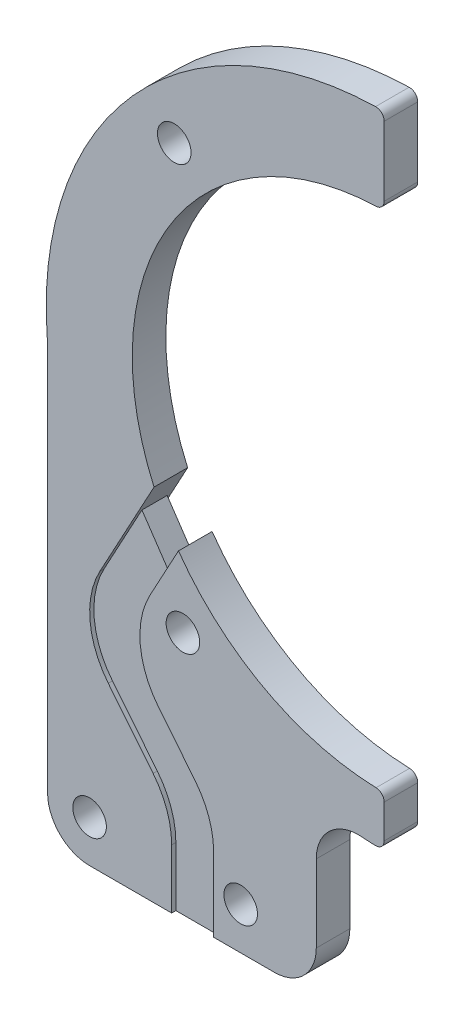
from build123d import *

# Parameters (mm, degrees)
SKETCH1_R               = 2
BOSS_EXTRUDE1_DEPTH     = 4
FILLET10_R              = 1
FILLET11_R              = 10
FILLET12_R              = 5
FILLET13_R              = 5
FILLET14_R              = 5
SKETCH2_R               = 2
CUT_EXTRUDE1_DEPTH      = 20
CUT_EXTRUDE2_DEPTH      = 0.5
FILLET15_R              = 10
CUT_EXTRUDE3_DEPTH      = 97.958369289
CUT_EXTRUDE3_DEPTH_BACK = 97.958369289
FILLET15_OF_MIRROR1_R   = 10


with BuildPart() as part:
    # Sketch1 → Boss-Extrude1 (new body)
    with BuildSketch(Plane.XY):
        with BuildLine():
            Line((-5, -5), (-5, 46.428571429))
            ThreePointArc((-5, 46.428571429), (5.360662074, 77.221028176), (35.086282243, 90.332329282))
            Line((35.086282243, 90.332329282), (35.086282243, 80.08008038))
            ThreePointArc((35.086282243, 80.08008038), (5.086282243, 50.08008038), (35.086282243, 20.08008038))
            Line((35.086282243, 20.08008038), (35.086282243, 14.08008038))
            ThreePointArc((35.086282243, 14.08008038), (31.017062028, 14.31079961), (27, 15))
            Line((27, 15), (27, -5))
            Line((27, -5), (-5, -5))
        make_face()
        Circle(SKETCH1_R, mode=Mode.SUBTRACT)
        with Locations((18, 0)):
            Circle(SKETCH1_R, mode=Mode.SUBTRACT)
    extrude(amount=BOSS_EXTRUDE1_DEPTH)

    # Fillet10
    fillet10_edges = [part.edges().sort_by_distance(p)[0] for p in [
        (35.086282243, 90.332329282, 2),
        (35.086282243, 80.08008038, 2),
        (35.086282243, 20.08008038, 2),
        (35.086282243, 14.08008038, 2),
    ]]
    fillet(fillet10_edges, radius=FILLET10_R)

    # Fillet11
    # the kernel refuses this fillet: 10 mm, written as the material it adds along each edge
    with BuildSketch(Plane(origin=(-5, 46.428571429, 0), x_dir=(-0.08596186737445177, 0.996298427860597, 0), z_dir=(0, 0, 1))) as fillet11_piece_1:
        with BuildLine():
            CenterArc((0.431926178, 9.999886119), FILLET11_R, 265.068661729, 4.657897264)
            Line((-0.427692496, 0.03690184), (0, 0))
            ThreePointArc((0, 0), (0.19210095, 0.000458397), (0.3842019, 0))
        make_face()
    extrude(amount=4)

    # Fillet12
    fillet12_edges = [part.edges().sort_by_distance(p)[0] for p in [
        (-5, -5, 2),
    ]]
    fillet(fillet12_edges, radius=FILLET12_R)

    # Fillet13
    fillet13_edges = [part.edges().sort_by_distance(p)[0] for p in [
        (27, -5, 2),
    ]]
    fillet(fillet13_edges, radius=FILLET13_R)

    # Fillet14
    fillet14_edges = [part.edges().sort_by_distance(p)[0] for p in [
        (27, 15, 2),
    ]]
    fillet(fillet14_edges, radius=FILLET14_R)

    # Sketch2 → Cut-Extrude1 (cut)
    with BuildSketch(Plane.XY.offset(4)):
        with Locations((10.086282243, 74.574977808)):
            Circle(SKETCH2_R)
        with Locations((11.117766586, 24.574977808)):
            Circle(SKETCH2_R)
    extrude(amount=-CUT_EXTRUDE1_DEPTH, mode=Mode.SUBTRACT)

    # Sketch3 → Cut-Extrude2 (cut)
    with BuildSketch(Plane(origin=(0, 0, 0), x_dir=(-1, 0, 0), z_dir=(0, 0, -1))):
        with BuildLine():
            Line((-14.777268977, -5), (-14.777268977, 7.317916248))
            Line((-14.777268977, 7.317916248), (-4.032042708, 20.652353666))
            Line((-4.032042708, 20.652353666), (-10.590052553, 32.761456562))
            ThreePointArc((-10.590052553, 32.761456562), (-9.00780857, 35.250609355), (-7.677638466, 37.883103447))
            Line((-7.677638466, 37.883103447), (1.949636164, 20.106725877))
            Line((1.949636164, 20.106725877), (-9.777268977, 5.554060462))
            Line((-9.777268977, 5.554060462), (-9.777268977, -5))
            Line((-9.777268977, -5), (-14.777268977, -5))
        make_face()
    cut_extrude2 = extrude(amount=-CUT_EXTRUDE2_DEPTH, mode=Mode.SUBTRACT)

    # Fillet15
    fillet15_edges = [part.edges().sort_by_distance(p)[0] for p in [
        (14.777268977, 7.317916248, 0.25),
        (4.032042708, 20.652353666, 0.25),
        (-1.949636164, 20.106725877, 0.25),
        (9.777268977, 5.554060462, 0.25),
    ]]
    fillet(fillet15_edges, radius=FILLET15_R)

    # Sketch4 → Cut-Extrude3 (cut, two sides: drawn at the far end of the back side and taken through both)
    with BuildSketch(Plane(origin=(0, 0, 0.5), x_dir=(-1, 0, 0), z_dir=(0, 0, -1)).offset(-CUT_EXTRUDE3_DEPTH_BACK)):
        with BuildLine():
            Line((-10.590052553, 32.761456562), (-8.89610131, 29.63364334))
            Line((-8.89610131, 29.63364334), (-5.738375915, 34.302332705))
            Line((-5.738375915, 34.302332705), (-7.677638466, 37.883103447))
            ThreePointArc((-7.677638466, 37.883103447), (-9.00780857, 35.250609355), (-10.590052553, 32.761456562))
        make_face()
    extrude(amount=CUT_EXTRUDE3_DEPTH + CUT_EXTRUDE3_DEPTH_BACK, mode=Mode.SUBTRACT)

    # Mirror1: Cut-Extrude2 across plane
    add(cut_extrude2.mirror(Plane.XY.offset(2)), mode=Mode.SUBTRACT)

    # Fillet15 of Mirror1
    fillet15_of_mirror1_edges = [part.edges().sort_by_distance(p)[0] for p in [
        (14.777268977, 7.317916248, 3.75),
        (4.032042708, 20.652353666, 3.75),
        (-1.949636164, 20.106725877, 3.75),
        (9.777268977, 5.554060462, 3.75),
    ]]
    fillet(fillet15_of_mirror1_edges, radius=FILLET15_OF_MIRROR1_R)


solid = part.part
